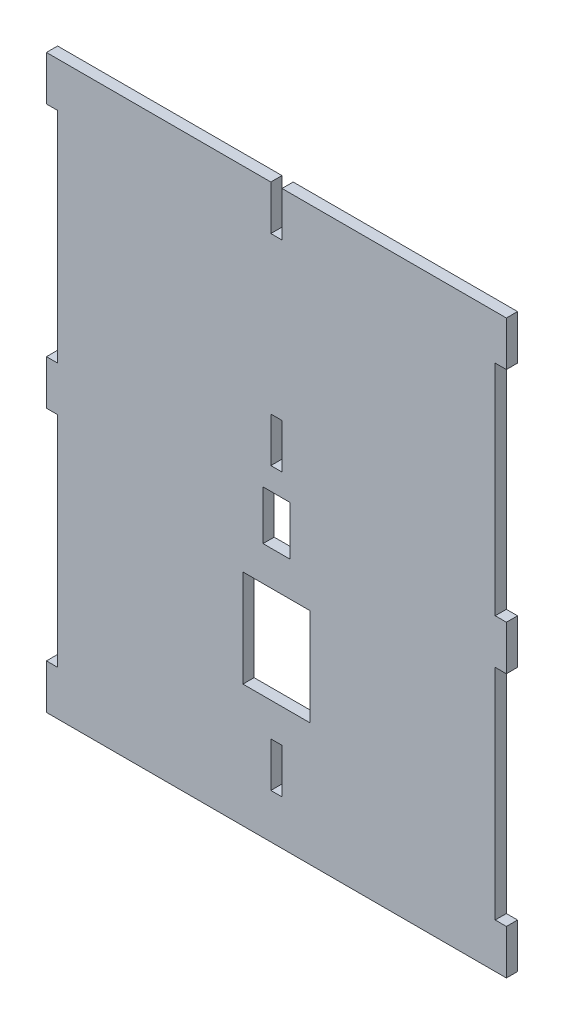
from build123d import *

# Parameters (mm, degrees)
ESQUISSE1_W        = 5
ESQUISSE1_H        = 20
ESQUISSE1_W_2      = 30
ESQUISSE1_H_2      = 43.5
ESQUISSE1_W_3      = 12
ESQUISSE1_H_3      = 22
BOSS_EXTRU_1_DEPTH = 5


with BuildPart() as part:
    # Esquisse1 → Boss.-Extru.1 (new body)
    with BuildSketch(Plane.XY):
        Polygon((103, 0), (103, -20), (98, -20), (98, -118), (103, -118), (103, -138), (98, -138), (98, -236), (103, -236), (103, -256), (-103, -256), (-103, -236), (-98, -236), (-98, -138), (-103, -138), (-103, -118), (-98, -118), (-98, -20), (-103, -20), (-103, 0), (-2.5, 0), (-2.5, -20), (2.5, -20), (2.5, 0), align=None)
        with Locations((0, -100)):
            Rectangle(ESQUISSE1_W, ESQUISSE1_H, mode=Mode.SUBTRACT)
        with Locations((0, -226)):
            Rectangle(ESQUISSE1_W, ESQUISSE1_H, mode=Mode.SUBTRACT)
        with Locations((0, -179.25)):
            Rectangle(ESQUISSE1_W_2, ESQUISSE1_H_2, mode=Mode.SUBTRACT)
        with Locations((0, -131)):
            Rectangle(ESQUISSE1_W_3, ESQUISSE1_H_3, mode=Mode.SUBTRACT)
    extrude(amount=BOSS_EXTRU_1_DEPTH)


solid = part.part
